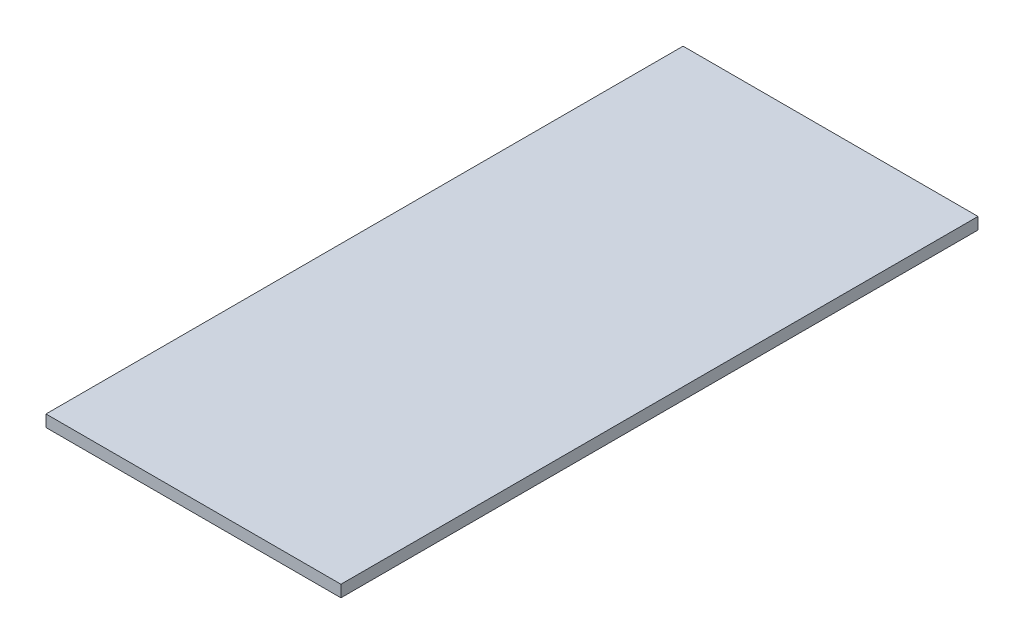
from build123d import *

# Parameters (mm, degrees)
SKETCH2_W           = 250
SKETCH2_H           = 540
BOSS_EXTRUDE1_DEPTH = 10


with BuildPart() as part:
    # Sketch2 → Boss-Extrude1 (new body)
    with BuildSketch(Plane.XZ.offset(-29.143326369)):
        with Locations((-205.300605602, 88.433128803)):
            Rectangle(SKETCH2_W, SKETCH2_H)
    extrude(amount=BOSS_EXTRUDE1_DEPTH)


solid = part.part
